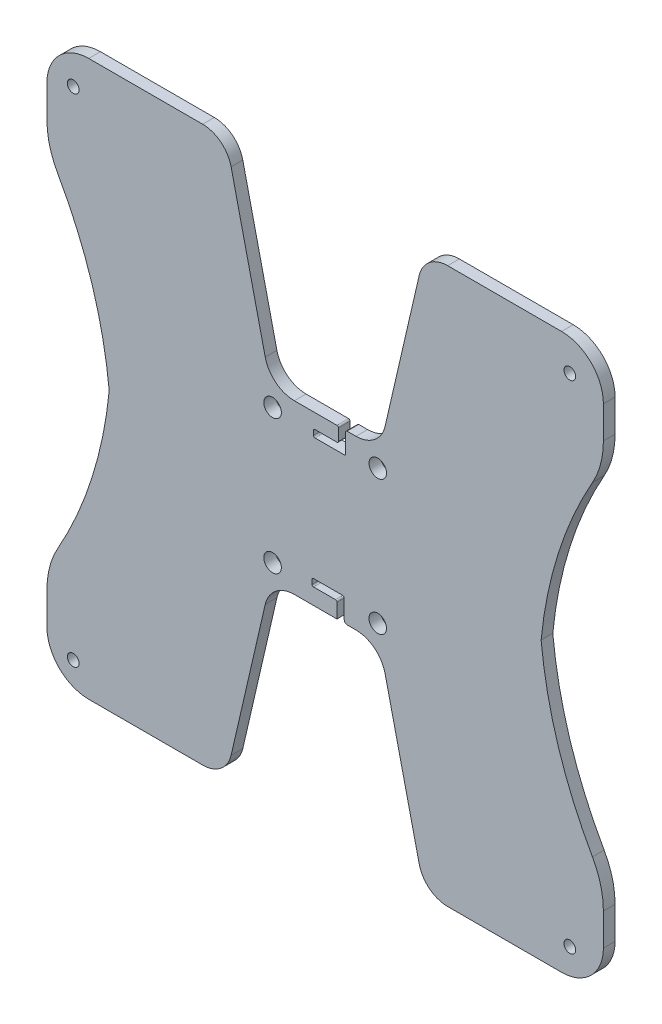
from build123d import *

# Parameters (mm, degrees)
BOSS_EXTRUDE1_DEPTH = 4
SKETCH3_R           = 2
SKETCH3_R_2         = 3
CUT_EXTRUDE1_DEPTH  = 4


with BuildPart() as part:
    # Sketch2 → Boss-Extrude1 (new body)
    with BuildSketch(Plane.XY):
        with BuildLine():
            Line((94.375415976, -52.704406223), (94.375415976, -56.704406223))
            ThreePointArc((94.375415976, -56.704406223), (94.228969367, -57.057959614), (93.875415976, -57.204406223))
            Line((93.875415976, -57.204406223), (86.375415976, -57.204406223))
            ThreePointArc((86.375415976, -57.204406223), (86.021862586, -57.350852833), (85.875415976, -57.704406223))
            Line((85.875415976, -57.704406223), (85.875415976, -59.204406223))
            ThreePointArc((85.875415976, -59.204406223), (86.021862586, -59.557959614), (86.375415976, -59.704406223))
            Line((86.375415976, -59.704406223), (96.375415976, -59.704406223))
            ThreePointArc((96.375415976, -59.704406223), (96.728969367, -59.557959614), (96.875415976, -59.204406223))
            Line((96.875415976, -59.204406223), (96.875415976, -52.704406223))
            ThreePointArc((96.875415976, -52.704406223), (97.021862586, -52.350852833), (97.375415976, -52.204406223))
            Line((97.375415976, -52.204406223), (100.375415976, -52.204406223))
            ThreePointArc((100.375415976, -52.204406223), (106.756191002, -49.976139831), (110.36270914, -44.260154531))
            Line((110.36270914, -44.260154531), (122.04253828, 6.330743606))
            ThreePointArc((122.04253828, 6.330743606), (125.561092562, 11.907314631), (131.786238928, 14.081233063))
            Line((131.786238928, 14.081233063), (170.7844924, 14.081233063))
            ThreePointArc((170.7844924, 14.081233063), (180.903868338, 9.889650306), (185.095451094, -0.229725632))
            Line((185.095451094, -0.229725632), (185.095451094, -11.229725632))
            ThreePointArc((185.095451094, -11.229725632), (184.144121557, -18.570812299), (181.352982104, -25.42691337))
            ThreePointArc((181.352982104, -25.42691337), (169.65700257, -52.25234878), (163.771733482, -80.918766937))
            ThreePointArc((163.771733482, -80.918766937), (169.65700257, -109.585185095), (181.352982104, -136.410620505))
            ThreePointArc((181.352982104, -136.410620505), (184.144121557, -143.266721576), (185.095451094, -150.607808243))
            Line((185.095451094, -150.607808243), (185.095451094, -161.607808243))
            ThreePointArc((185.095451094, -161.607808243), (180.903868338, -171.727184181), (170.7844924, -175.918766937))
            Line((170.7844924, -175.918766937), (131.786238928, -175.918766937))
            ThreePointArc((131.786238928, -175.918766937), (125.561092562, -173.744848506), (122.04253828, -168.168277481))
            Line((122.04253828, -168.168277481), (110.36270914, -117.577379344))
            ThreePointArc((110.36270914, -117.577379344), (106.756191002, -111.861394044), (100.375415976, -109.633127651))
            Line((100.375415976, -109.633127651), (97.375415976, -109.633127651))
            ThreePointArc((97.375415976, -109.633127651), (96.668309195, -109.340234433), (96.375415976, -108.633127651))
            Line((96.375415976, -108.633127651), (96.375415976, -102.133127651))
            ThreePointArc((96.375415976, -102.133127651), (96.228969367, -101.779574261), (95.875415976, -101.633127651))
            Line((95.875415976, -101.633127651), (85.875415976, -101.633127651))
            ThreePointArc((85.875415976, -101.633127651), (85.521862586, -101.779574261), (85.375415976, -102.133127651))
            Line((85.375415976, -102.133127651), (85.375415976, -103.633127651))
            ThreePointArc((85.375415976, -103.633127651), (85.521862586, -103.986681042), (85.875415976, -104.133127651))
            Line((85.875415976, -104.133127651), (93.375415976, -104.133127651))
            ThreePointArc((93.375415976, -104.133127651), (93.728969367, -104.279574261), (93.875415976, -104.633127651))
            Line((93.875415976, -104.633127651), (93.875415976, -108.633127651))
            Line((93.875415976, -108.633127651), (93.875415976, -109.633127651))
            Line((93.875415976, -109.633127651), (82.315486211, -109.633127651))
            Line((82.315486211, -109.633127651), (79.315486211, -109.633127651))
            ThreePointArc((79.315486211, -109.633127651), (72.934711186, -111.861394044), (69.328193047, -117.577379344))
            Line((69.328193047, -117.577379344), (57.648363907, -168.168277481))
            ThreePointArc((57.648363907, -168.168277481), (54.129809626, -173.744848506), (47.904663259, -175.918766937))
            Line((47.904663259, -175.918766937), (8.906409788, -175.918766937))
            ThreePointArc((8.906409788, -175.918766937), (-1.21296615, -171.727184181), (-5.404548906, -161.607808243))
            Line((-5.404548906, -161.607808243), (-5.404548906, -150.607808243))
            ThreePointArc((-5.404548906, -150.607808243), (-4.453219369, -143.266721576), (-1.662079916, -136.410620505))
            ThreePointArc((-1.662079916, -136.410620505), (10.033899618, -109.585185095), (15.919168706, -80.918766937))
            ThreePointArc((15.919168706, -80.918766937), (10.033899618, -52.25234878), (-1.662079916, -25.42691337))
            ThreePointArc((-1.662079916, -25.42691337), (-4.453219369, -18.570812299), (-5.404548906, -11.229725632))
            Line((-5.404548906, -11.229725632), (-5.404548906, -0.229725632))
            ThreePointArc((-5.404548906, -0.229725632), (-1.21296615, 9.889650306), (8.906409788, 14.081233063))
            Line((8.906409788, 14.081233063), (47.904663259, 14.081233063))
            ThreePointArc((47.904663259, 14.081233063), (54.129809626, 11.907314631), (57.648363907, 6.330743606))
            Line((57.648363907, 6.330743606), (69.328193047, -44.260154531))
            ThreePointArc((69.328193047, -44.260154531), (72.934711186, -49.976139831), (79.315486211, -52.204406223))
            Line((79.315486211, -52.204406223), (82.315486211, -52.204406223))
            Line((82.315486211, -52.204406223), (93.875415976, -52.204406223))
            ThreePointArc((93.875415976, -52.204406223), (94.228969367, -52.350852833), (94.375415976, -52.704406223))
        make_face()
    extrude(amount=BOSS_EXTRUDE1_DEPTH)

    # Sketch3 → Cut-Extrude1 (cut)
    with BuildSketch(Plane.XY.offset(4)):
        with Locations((3.595451094, 3.081233063)):
            Circle(SKETCH3_R)
        with Locations((3.595451094, -166.918766937)):
            Circle(SKETCH3_R)
        with Locations((71.845451094, -57.918766937)):
            Circle(SKETCH3_R_2)
        with Locations((107.845451094, -57.918766937)):
            Circle(SKETCH3_R_2)
        with Locations((71.845451094, -103.918766937)):
            Circle(SKETCH3_R_2)
        with Locations((107.845451094, -103.918766937)):
            Circle(SKETCH3_R_2)
        with Locations((173.595451094, -166.918766937)):
            Circle(SKETCH3_R)
        with Locations((173.595451094, 3.081233063)):
            Circle(SKETCH3_R)
    extrude(amount=-CUT_EXTRUDE1_DEPTH, mode=Mode.SUBTRACT)


solid = part.part
